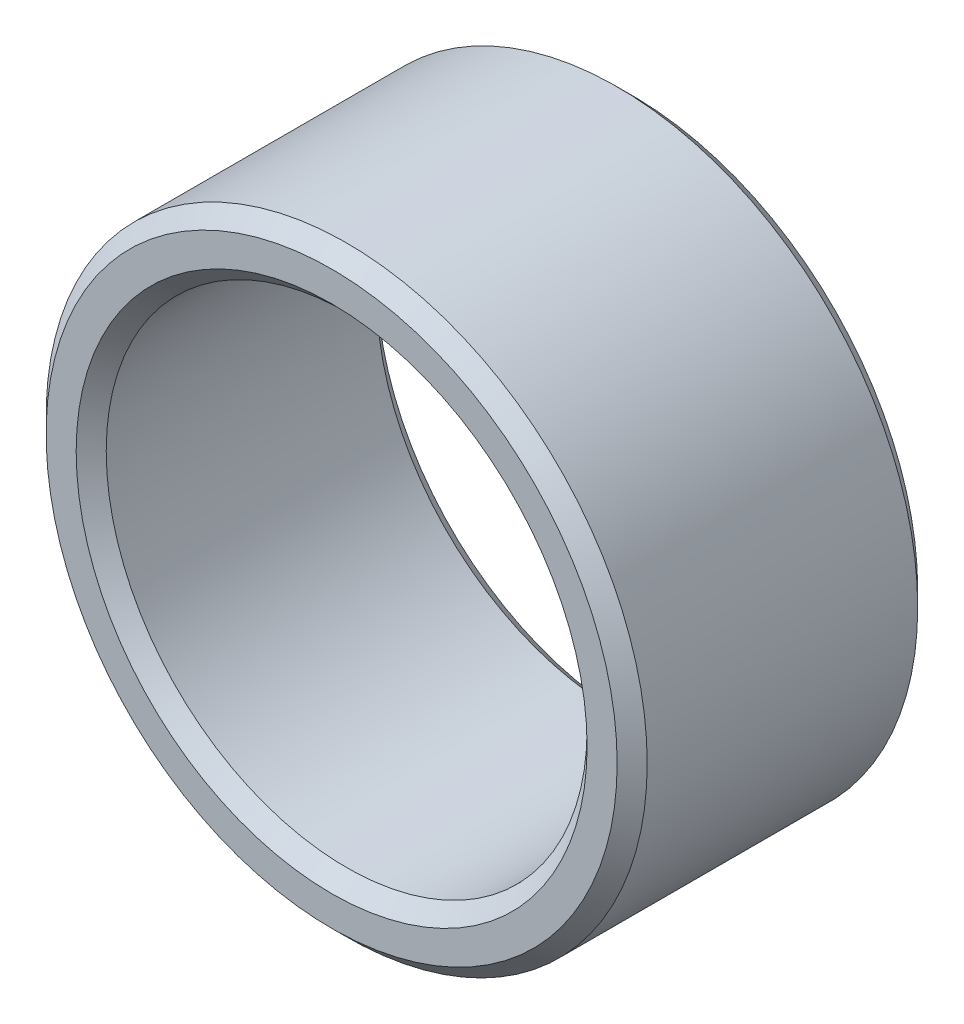
from build123d import *

# Parameters (mm, degrees)
ESQUISSE1_R        = 20
ESQUISSE1_R_2      = 16
BOSS_EXTRU_1_DEPTH = 20
CHANFREIN1_SIZE    = 1


with BuildPart() as part:
    # Esquisse1 → Boss.-Extru.1 (new body)
    with BuildSketch(Plane.XY):
        Circle(ESQUISSE1_R)
        Circle(ESQUISSE1_R_2, mode=Mode.SUBTRACT)
    extrude(amount=BOSS_EXTRU_1_DEPTH)

    # Chanfrein1
    chanfrein1_edges = [part.edges().sort_by_distance(p)[0] for p in [
        (-16, 0, 0),
        (-20, 0, 0),
        (-16, 0, 20),
        (-20, 0, 20),
    ]]
    chamfer(chanfrein1_edges, length=CHANFREIN1_SIZE)


solid = part.part
